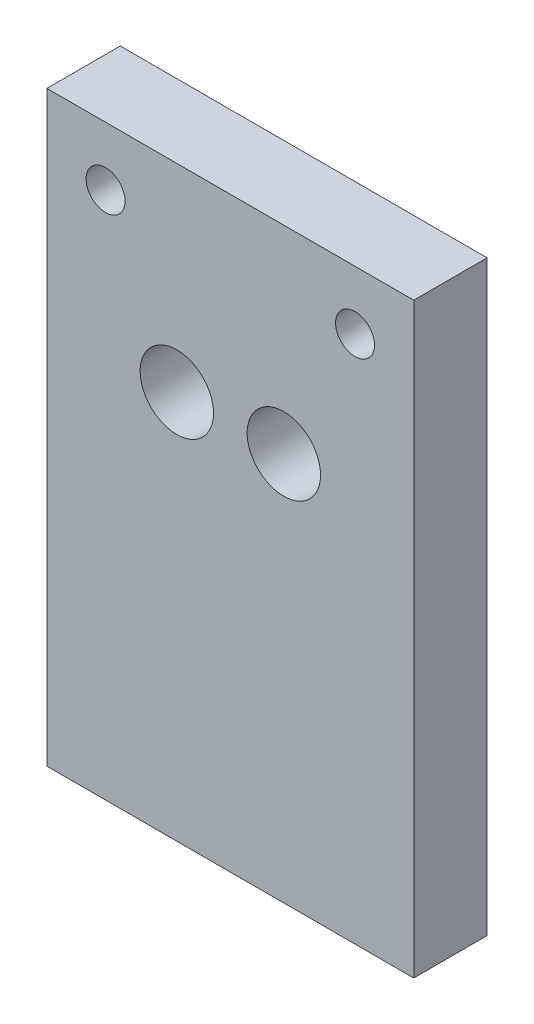
from build123d import *

# Parameters (mm, degrees)
SKETCH1_W               = 63.5
SKETCH1_H               = 134.62
SKETCH1_R               = 6.35
BOSS_EXTRUDE1_DEPTH     = 12.7
SKETCH2_W               = 63.5
SKETCH2_H               = 33.02
CUT_EXTRUDE1_DEPTH      = 76.498268854
F_1_4_CLEARANCE_HOLE1_D = 6.7564


with BuildPart() as part:
    # Sketch1 → Boss-Extrude1 (new body)
    with BuildSketch(Plane.XY):
        Rectangle(SKETCH1_W, SKETCH1_H)
        with Locations((-9.26084, 0)):
            Circle(SKETCH1_R, mode=Mode.SUBTRACT)
        with Locations((9.26084, 0)):
            Circle(SKETCH1_R, mode=Mode.SUBTRACT)
    extrude(amount=BOSS_EXTRUDE1_DEPTH)

    # Sketch2 → Cut-Extrude1 (cut, through all)
    with BuildSketch(Plane.XY.offset(12.7)):
        with Locations((0, 50.8)):
            Rectangle(SKETCH2_W, SKETCH2_H)
    extrude(amount=-CUT_EXTRUDE1_DEPTH, mode=Mode.SUBTRACT)

    # 1/4 Clearance Hole1 (through all)
    with Locations(Plane.XY.offset(12.7)):
        with Locations((-21.59, 24.13)):
            f_1_4_clearance_hole1 = Hole(F_1_4_CLEARANCE_HOLE1_D / 2)

    # Mirror1: 1/4 Clearance Hole1 across plane
    add(f_1_4_clearance_hole1.mirror(Plane(origin=(0, 0, 0), x_dir=(0, 0, 1), z_dir=(1, 0, 0))), mode=Mode.SUBTRACT)

    # Sketch8 → #10-32 Tapped Hole1 (revolve, cut)
    with BuildSketch(Plane(origin=(-21.59, -67.31, 6.35), x_dir=(0, 0, -1), z_dir=(1, 0, 0))):
        Polygon((0, 0), (0, 13.913317848), (2.0193, 12.7), (2.0193, 0), align=None)
    f_10_32_tapped_hole1 = revolve(axis=Axis((-21.59, -73.66, 6.35), (0, 1, 0)), mode=Mode.SUBTRACT)

    # Mirror2: #10-32 Tapped Hole1 across plane
    add(f_10_32_tapped_hole1.mirror(Plane(origin=(0, 0, 0), x_dir=(0, 0, 1), z_dir=(1, 0, 0))), mode=Mode.SUBTRACT)


solid = part.part
